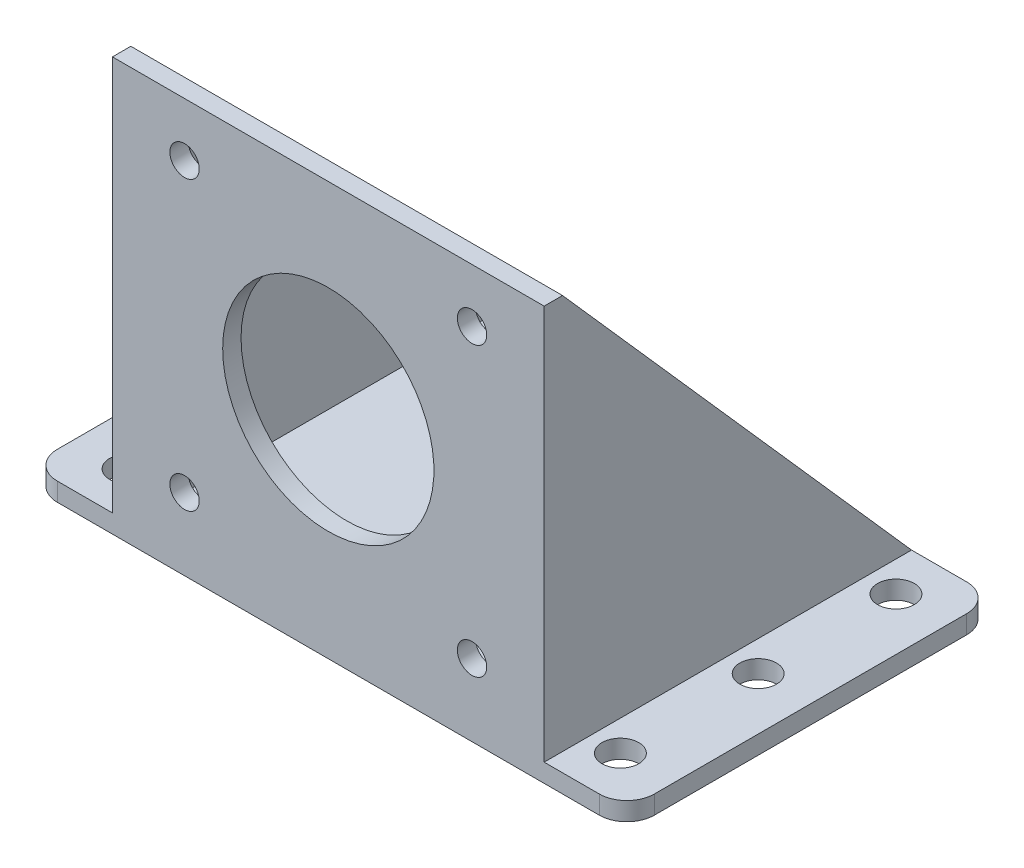
from build123d import *

# Parameters (mm, degrees)
SKETCH_1_W          = 65
SKETCH_1_H          = 40
EXTRUDE_1_DEPTH     = 2
SKETCH_2_R          = 2
CUT_EXTRUDE_1_DEPTH = 77.347887987
SKETCH_3_W          = 47
SKETCH_3_H          = 43
EXTRUDE_2_DEPTH     = 2
RIB_1_REACH         = 84.225
SKETCH_5_WALL_W     = 223.835267426
SKETCH_5_WALL_H     = 2
RIB_2_REACH         = 84.225
SKETCH_6_WALL_W     = 223.835267426
SKETCH_6_WALL_H     = 2
SKETCH_7_R          = 11.5
SKETCH_7_R_2        = 1.6
CUT_EXTRUDE_2_DEPTH = 88.715449038
FILLET_1_R          = 3


with BuildPart() as part:
    # 草图1 → 凸台-拉伸1 (new body)
    with BuildSketch(Plane(origin=(0, 0, 0), x_dir=(1, 0, 0), z_dir=(0, 1, 0))):
        with Locations((32.5, 20)):
            Rectangle(SKETCH_1_W, SKETCH_1_H)
    extrude(amount=EXTRUDE_1_DEPTH)

    # 草图2 → 切除-拉伸1 (cut, through all)
    with BuildSketch(Plane(origin=(0, 2, 0), x_dir=(1, 0, 0), z_dir=(0, 1, 0))):
        with Locations((5.7, 5)):
            Circle(SKETCH_2_R)
        with Locations((5.7, 20)):
            Circle(SKETCH_2_R)
        with Locations((5.7, 35)):
            Circle(SKETCH_2_R)
        with Locations((59.3, 5)):
            Circle(SKETCH_2_R)
        with Locations((59.3, 20)):
            Circle(SKETCH_2_R)
        with Locations((59.3, 35)):
            Circle(SKETCH_2_R)
    extrude(amount=-CUT_EXTRUDE_1_DEPTH, mode=Mode.SUBTRACT)

    # 草图3 → 凸台-拉伸2 (add)
    with BuildSketch(Plane.XY):
        with Locations((32.5, 23.5)):
            Rectangle(SKETCH_3_W, SKETCH_3_H)
    extrude(amount=-EXTRUDE_2_DEPTH)

    # 草图5 wall → 筋1 (add, up to next)
    with BuildSketch(Plane(origin=(9, 23.5, -21), x_dir=(0, 0.749329085481, 0.662197796472), z_dir=(0, 0.662197796472, -0.749329085481)), mode=Mode.PRIVATE) as rib_1_sk1:
        with Locations((0, 1)):
            Rectangle(SKETCH_5_WALL_W, SKETCH_5_WALL_H)
    rib_1_tool1 = extrude(rib_1_sk1.sketch, amount=-RIB_1_REACH, mode=Mode.PRIVATE) - part.part
    add(rib_1_tool1.solids().sort_by_distance((9, 23.5, -21))[0])

    # 草图6 wall → 筋2 (add, up to next)
    with BuildSketch(Plane(origin=(56, 23.5, -21), x_dir=(0, -0.749329085481, -0.662197796472), z_dir=(0, 0.662197796472, -0.749329085481)), mode=Mode.PRIVATE) as rib_2_sk1:
        with Locations((0, 1)):
            Rectangle(SKETCH_6_WALL_W, SKETCH_6_WALL_H)
    rib_2_tool1 = extrude(rib_2_sk1.sketch, amount=-RIB_2_REACH, mode=Mode.PRIVATE) - part.part
    add(rib_2_tool1.solids().sort_by_distance((56, 23.5, -21))[0])

    # 草图7 → 切除-拉伸2 (cut, through all)
    with BuildSketch(Plane(origin=(0, 0, -2), x_dir=(-1, 0, 0), z_dir=(0, 0, -1))):
        with Locations((-32.5, 23.5)):
            Circle(SKETCH_7_R)
        with Locations((-48.15, 7.85)):
            Circle(SKETCH_7_R_2)
        with Locations((-16.85, 7.85)):
            Circle(SKETCH_7_R_2)
        with Locations((-16.85, 39.15)):
            Circle(SKETCH_7_R_2)
        with Locations((-48.15, 39.15)):
            Circle(SKETCH_7_R_2)
    extrude(amount=-CUT_EXTRUDE_2_DEPTH, mode=Mode.SUBTRACT)

    # 圆角1
    fillet_1_edges = [part.edges().sort_by_distance(p)[0] for p in [
        (65, 1, -40),
        (65, 1, 0),
        (0, 1, -40),
        (0, 1, 0),
    ]]
    fillet(fillet_1_edges, radius=FILLET_1_R)


solid = part.part
